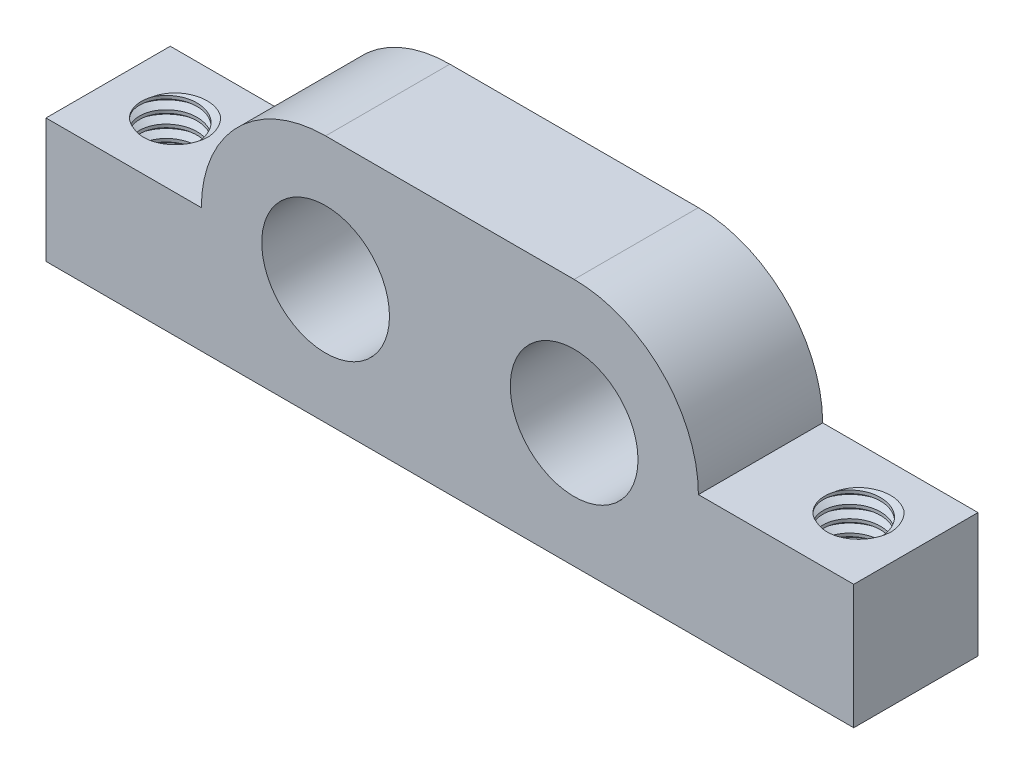
from build123d import *

# Parameters (mm, degrees)
SKETCH1_R           = 3.2639
BOSS_EXTRUDE1_DEPTH = 6.35
CUT_EXTRUDE1_REACH  = 44.241
SKETCH2_R           = 1.4732
THREAD1_PITCH       = 0.635
THREAD2_PITCH       = 0.635


with BuildPart() as part:
    # Sketch1 → Boss-Extrude1 (new body)
    with BuildSketch(Plane.XY):
        with BuildLine():
            Line((0, 0), (41.275, 0))
            Line((41.275, 0), (41.275, 6.35))
            Line((41.275, 6.35), (33.3375, 6.35))
            ThreePointArc((33.3375, 6.35), (31.477628061, 10.840128061), (26.9875, 12.7))
            Line((26.9875, 12.7), (14.2875, 12.7))
            ThreePointArc((14.2875, 12.7), (9.797371939, 10.840128061), (7.9375, 6.35))
            Line((7.9375, 6.35), (0, 6.35))
            Line((0, 6.35), (0, 0))
        make_face()
        with Locations((14.2875, 6.35)):
            Circle(SKETCH1_R, mode=Mode.SUBTRACT)
        with Locations((26.9875, 6.35)):
            Circle(SKETCH1_R, mode=Mode.SUBTRACT)
    extrude(amount=BOSS_EXTRUDE1_DEPTH)

    # Sketch2 → Cut-Extrude1 (cut, up to next)
    with BuildSketch(Plane(origin=(0, 6.35, 0), x_dir=(1, 0, 0), z_dir=(0, 1, 0)), mode=Mode.PRIVATE) as cut_extrude1_sk1:
        with Locations(Location((38.1, -3.175, 0), (0, 0, 270))):
            Circle(SKETCH2_R)
    cut_extrude1_tool1 = extrude(cut_extrude1_sk1.sketch, amount=-CUT_EXTRUDE1_REACH, mode=Mode.PRIVATE) & part.part
    # Sketch2 → Cut-Extrude1 (cut, up to next)
    with BuildSketch(Plane(origin=(0, 6.35, 0), x_dir=(1, 0, 0), z_dir=(0, 1, 0)), mode=Mode.PRIVATE) as cut_extrude1_sk2:
        with Locations(Location((3.175, -3.175, 0), (0, 0, 270))):
            Circle(SKETCH2_R)
    cut_extrude1_tool2 = extrude(cut_extrude1_sk2.sketch, amount=-CUT_EXTRUDE1_REACH, mode=Mode.PRIVATE) & part.part
    add(cut_extrude1_tool1.solids().sort_by_distance((38.1, 6.35, 3.175))[0], mode=Mode.SUBTRACT)
    add(cut_extrude1_tool2.solids().sort_by_distance((3.175, 6.35, 3.175))[0], mode=Mode.SUBTRACT)

    # Thread1: the profile of Thread Profile1 profile screwed along a right-hand helix of 10.8 turns, 6 arcs to a turn; built about Z, then put on its axis
    thread1_z = Axis((0, 0, 0), (0, 0, 1))
    thread1_corners = [(1.4729, 0, -0.000173205), (1.816903831, 0, 0.198437499), (1.816903831, 0, 0.277812499), (1.4729, 0, 0.476423203)]
    with BuildLine(mode=Mode.PRIVATE) as thread1_profile:
        Line(thread1_corners[0], thread1_corners[1])
        Line(thread1_corners[1], thread1_corners[2])
        Line(thread1_corners[2], thread1_corners[3])
        Line(thread1_corners[3], thread1_corners[0])
    thread1_cap = Face(thread1_profile.wire())
    thread1_turn_angles = [0, 30, 60, 90, 120, 150, 180, 210, 240, 270, 300, 330, 360]
    thread1_turn_weights = [1, 0.8660254037844387, 1, 0.8660254037844387, 1, 0.8660254037844387, 1, 0.8660254037844387, 1, 0.8660254037844387, 1, 0.8660254037844387, 1]
    thread1_turn_rails = [Edge.make_bspline([Vector(p[0], p[1], 0).rotate(thread1_z, thread1_turn_angles[k]) / thread1_turn_weights[k] + Vector(0, 0, p[2] + THREAD1_PITCH * thread1_turn_angles[k] / 360) for k in range(13)], [0, 0, 0, 1, 1, 2, 2, 3, 3, 4, 4, 5, 5, 6, 6, 6], 2, thread1_turn_weights) for p in thread1_corners]
    thread1_turn_sides = [Face.make_surface_from_curves(thread1_turn_rails[p[0]], thread1_turn_rails[p[1]]) for p in [(0, 1), (1, 2), (2, 3), (3, 0)]]
    thread1_last_angles = [3600, 3630, 3660, 3690, 3720, 3750, 3780, 3810, 3840, 3864, 3888]
    thread1_last_weights = [1, 0.8660254037844387, 1, 0.8660254037844387, 1, 0.8660254037844387, 1, 0.8660254037844387, 1, 0.9135454576426009, 1]
    thread1_last_rails = [Edge.make_bspline([Vector(p[0], p[1], 0).rotate(thread1_z, thread1_last_angles[k]) / thread1_last_weights[k] + Vector(0, 0, p[2] + THREAD1_PITCH * thread1_last_angles[k] / 360) for k in range(11)], [0, 0, 0, 1, 1, 2, 2, 3, 3, 4, 4, 5, 5, 5], 2, thread1_last_weights) for p in thread1_corners]
    thread1_last_sides = [Face.make_surface_from_curves(thread1_last_rails[p[0]], thread1_last_rails[p[1]]) for p in [(0, 1), (1, 2), (2, 3), (3, 0)]]
    thread1 = Plane(origin=(3.175, 6.858, 3.175), x_dir=(-1, 0, 0), z_dir=(0, -1, 0)) * Solid(Shell([*[p.moved(Location((0, 0, THREAD1_PITCH * i))) for i in range(10) for p in thread1_turn_sides], *thread1_last_sides, thread1_cap, thread1_cap.rotate(thread1_z, 3888).moved(Location((0, 0, THREAD1_PITCH * 3888 / 360)))]))
    add(thread1, mode=Mode.SUBTRACT)

    # Thread2: the profile of Thread Profile2 profile screwed along a right-hand helix of 10.8 turns, 6 arcs to a turn; built about Z, then put on its axis
    thread2_z = Axis((0, 0, 0), (0, 0, 1))
    thread2_corners = [(1.4729, 0, -0.000173205), (1.816903831, 0, 0.198437499), (1.816903831, 0, 0.277812499), (1.4729, 0, 0.476423203)]
    with BuildLine(mode=Mode.PRIVATE) as thread2_profile:
        Line(thread2_corners[0], thread2_corners[1])
        Line(thread2_corners[1], thread2_corners[2])
        Line(thread2_corners[2], thread2_corners[3])
        Line(thread2_corners[3], thread2_corners[0])
    thread2_cap = Face(thread2_profile.wire())
    thread2_turn_angles = [0, 30, 60, 90, 120, 150, 180, 210, 240, 270, 300, 330, 360]
    thread2_turn_weights = [1, 0.8660254037844387, 1, 0.8660254037844387, 1, 0.8660254037844387, 1, 0.8660254037844387, 1, 0.8660254037844387, 1, 0.8660254037844387, 1]
    thread2_turn_rails = [Edge.make_bspline([Vector(p[0], p[1], 0).rotate(thread2_z, thread2_turn_angles[k]) / thread2_turn_weights[k] + Vector(0, 0, p[2] + THREAD2_PITCH * thread2_turn_angles[k] / 360) for k in range(13)], [0, 0, 0, 1, 1, 2, 2, 3, 3, 4, 4, 5, 5, 6, 6, 6], 2, thread2_turn_weights) for p in thread2_corners]
    thread2_turn_sides = [Face.make_surface_from_curves(thread2_turn_rails[p[0]], thread2_turn_rails[p[1]]) for p in [(0, 1), (1, 2), (2, 3), (3, 0)]]
    thread2_last_angles = [3600, 3630, 3660, 3690, 3720, 3750, 3780, 3810, 3840, 3864, 3888]
    thread2_last_weights = [1, 0.8660254037844387, 1, 0.8660254037844387, 1, 0.8660254037844387, 1, 0.8660254037844387, 1, 0.9135454576426009, 1]
    thread2_last_rails = [Edge.make_bspline([Vector(p[0], p[1], 0).rotate(thread2_z, thread2_last_angles[k]) / thread2_last_weights[k] + Vector(0, 0, p[2] + THREAD2_PITCH * thread2_last_angles[k] / 360) for k in range(11)], [0, 0, 0, 1, 1, 2, 2, 3, 3, 4, 4, 5, 5, 5], 2, thread2_last_weights) for p in thread2_corners]
    thread2_last_sides = [Face.make_surface_from_curves(thread2_last_rails[p[0]], thread2_last_rails[p[1]]) for p in [(0, 1), (1, 2), (2, 3), (3, 0)]]
    thread2 = Plane(origin=(38.1, 6.858, 3.175), x_dir=(-1, 0, 0), z_dir=(0, -1, 0)) * Solid(Shell([*[p.moved(Location((0, 0, THREAD2_PITCH * i))) for i in range(10) for p in thread2_turn_sides], *thread2_last_sides, thread2_cap, thread2_cap.rotate(thread2_z, 3888).moved(Location((0, 0, THREAD2_PITCH * 3888 / 360)))]))
    add(thread2, mode=Mode.SUBTRACT)


solid = part.part
